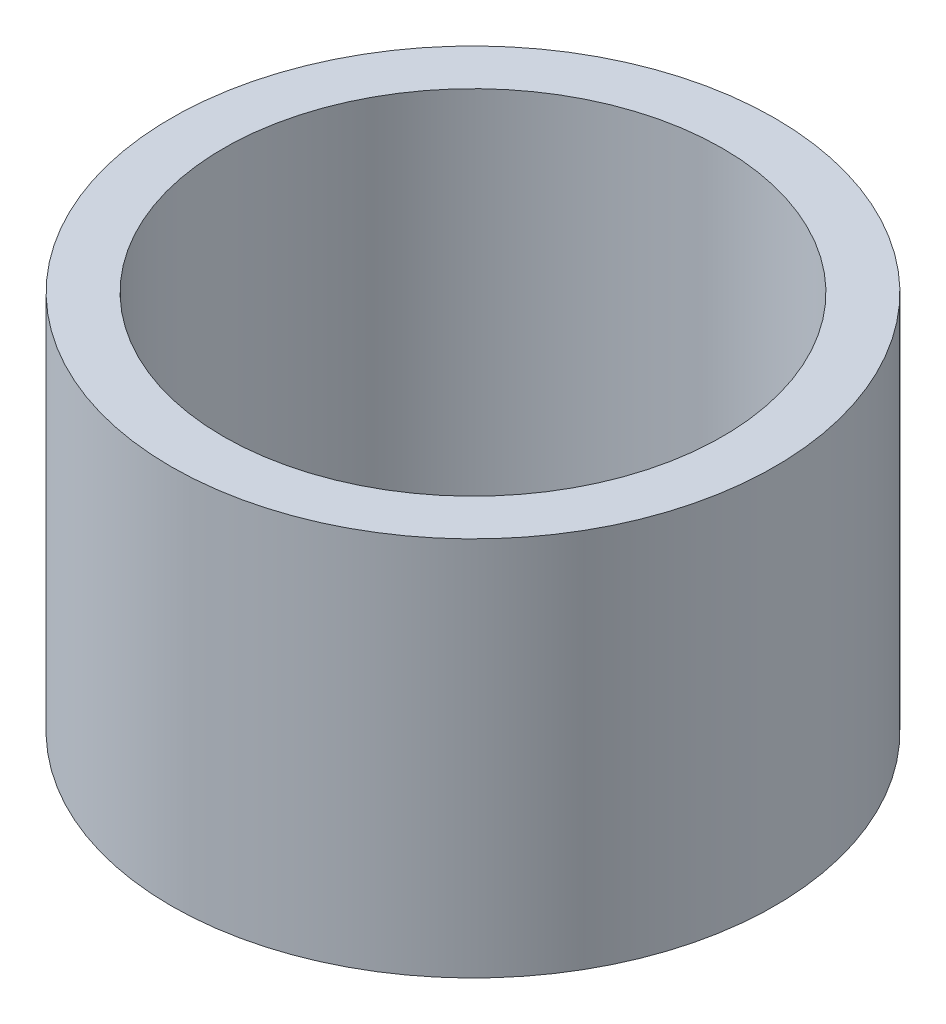
from build123d import *

# Parameters (mm, degrees)
SKETCH_1_R      = 6.35
SKETCH_1_R_2    = 5.25
EXTRUDE_1_DEPTH = 8


with BuildPart() as part:
    # Эскиз1 → Бобышка-Вытянуть1 (new body)
    with BuildSketch(Plane(origin=(0, 0, 0), x_dir=(1, 0, 0), z_dir=(0, 1, 0))):
        Circle(SKETCH_1_R)
        Circle(SKETCH_1_R_2, mode=Mode.SUBTRACT)
    extrude(amount=EXTRUDE_1_DEPTH)


solid = part.part
